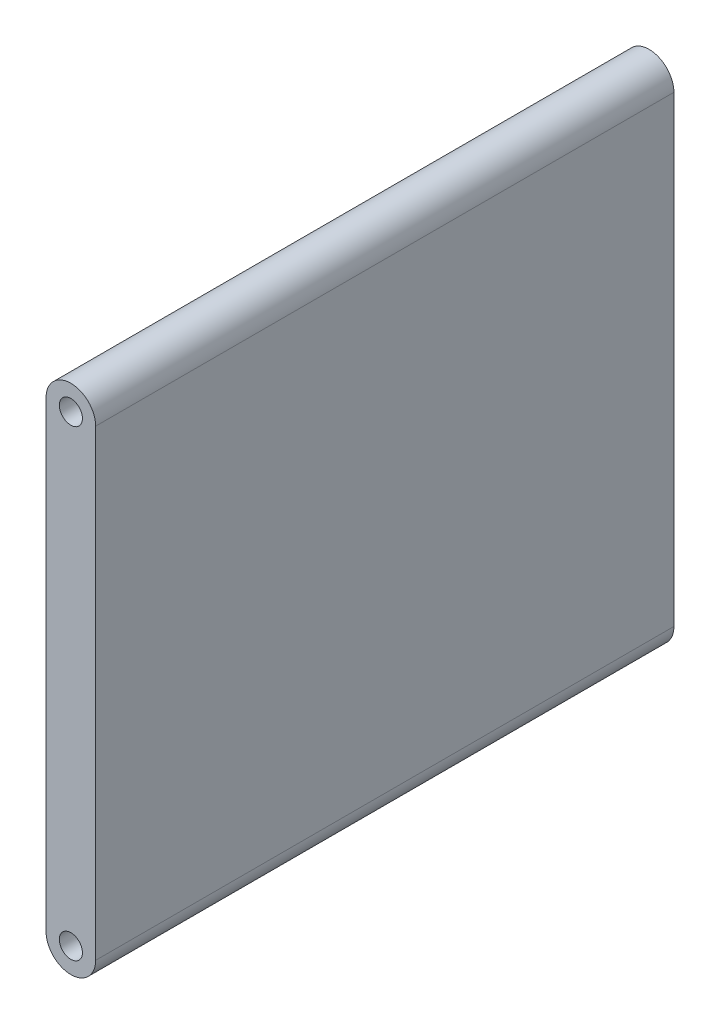
from build123d import *

# Parameters (mm, degrees)
CROQUIS1_R              = 1.4
SALIENTE_EXTRUIR1_DEPTH = 70


with BuildPart() as part:
    # Croquis1 → Saliente-Extruir1 (new body)
    with BuildSketch(Plane.XY):
        with BuildLine():
            Line((3, -28), (3, 28))
            ThreePointArc((3, 28), (0, 31), (-3, 28))
            Line((-3, 28), (-3, -28))
            ThreePointArc((-3, -28), (0, -31), (3, -28))
        make_face()
        with Locations((0, 28)):
            Circle(CROQUIS1_R, mode=Mode.SUBTRACT)
        with Locations((0, -28)):
            Circle(CROQUIS1_R, mode=Mode.SUBTRACT)
    extrude(amount=SALIENTE_EXTRUIR1_DEPTH)


solid = part.part
